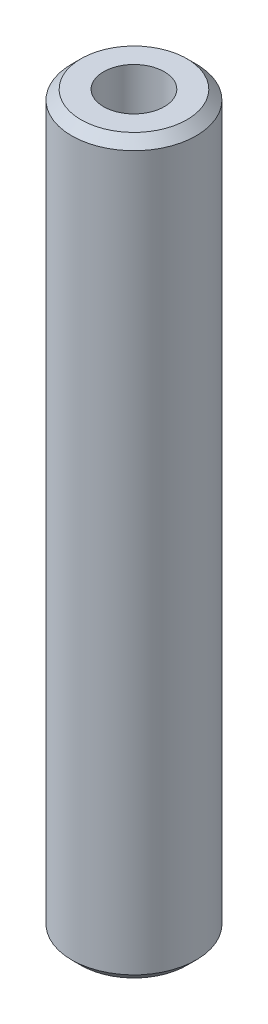
from build123d import *

# Parameters (mm, degrees)
SKETCH1_R           = 25
BOSS_EXTRUDE1_DEPTH = 294.233916915
SKETCH2_R           = 12.185999926
CUT_EXTRUDE1_DEPTH  = 297.35046459
CHAMFER1_SIZE       = 3.731980481


with BuildPart() as part:
    # Sketch1 → Boss-Extrude1 (new body)
    with BuildSketch(Plane(origin=(0, 0, 0), x_dir=(1, 0, 0), z_dir=(0, 1, 0))):
        Circle(SKETCH1_R)
    extrude(amount=BOSS_EXTRUDE1_DEPTH)

    # Sketch2 → Cut-Extrude1 (cut, through all)
    with BuildSketch(Plane(origin=(0, 0, 0), x_dir=(1, 0, 0), z_dir=(0, 1, 0))):
        Circle(SKETCH2_R)
    extrude(amount=CUT_EXTRUDE1_DEPTH, mode=Mode.SUBTRACT)

    # Chamfer1
    chamfer1_edges = [part.edges().sort_by_distance(p)[0] for p in [
        (-25, 294.233916915, 0),
        (-25, 0, 0),
    ]]
    chamfer(chamfer1_edges, length=CHAMFER1_SIZE)


solid = part.part
